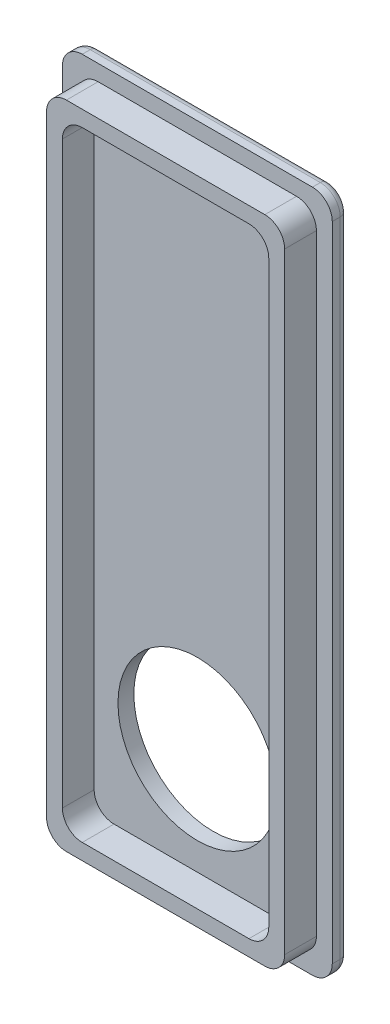
from build123d import *

# Parameters (mm, degrees)
ESQUISSE1_W             = 34
ESQUISSE1_H             = 86
BOSS_EXTRU_1_DEPTH      = 2
ESQUISSE2_W             = 30
ESQUISSE2_H             = 82
ESQUISSE2_W_2           = 26
ESQUISSE2_H_2           = 78
BOSS_EXTRU_2_DEPTH      = 4
CONG_3_R                = 1
CONG_2_R                = 2.5
ESQUISSE3_R             = 10
ENL_V_MAT_EXTRU_1_DEPTH = 4


with BuildPart() as part:
    # Esquisse1 → Boss.-Extru.1 (new body)
    with BuildSketch(Plane.XY):
        Rectangle(ESQUISSE1_W, ESQUISSE1_H)
    extrude(amount=BOSS_EXTRU_1_DEPTH)

    # Esquisse2 → Boss.-Extru.2 (add)
    with BuildSketch(Plane.XY.offset(2)):
        Rectangle(ESQUISSE2_W, ESQUISSE2_H)
        Rectangle(ESQUISSE2_W_2, ESQUISSE2_H_2, mode=Mode.SUBTRACT)
    extrude(amount=BOSS_EXTRU_2_DEPTH)

    # Congé3
    cong_3_edges = [part.edges().sort_by_distance(p)[0] for p in [
        (0, 43, 0),
        (17, 0, 0),
        (0, -43, 0),
        (-17, 0, 0),
    ]]
    fillet(cong_3_edges, radius=CONG_3_R)

    # Congé2
    # the kernel refuses this fillet: 2.5 mm, written as the material it adds along each edge
    with BuildSketch(Plane(origin=(-13, -39, 2), x_dir=(0, 1, 0), z_dir=(0, 0, 1)), Plane(origin=(13, 39, 2), x_dir=(0, -1, 0), z_dir=(0, 0, 1)), Plane(origin=(-13, 39, 2), x_dir=(1, 0, 0), z_dir=(0, 0, 1))) as cong_2_piece_1:
        with BuildLine():
            CenterArc((CONG_2_R, -CONG_2_R), CONG_2_R, 90, 90)
            Line((0, -CONG_2_R), (-CONG_2_R * 0.02, -CONG_2_R))
            Line((-CONG_2_R * 0.02, -CONG_2_R), (-CONG_2_R * 0.02, CONG_2_R * 0.02))
            Line((-CONG_2_R * 0.02, CONG_2_R * 0.02), (CONG_2_R, CONG_2_R * 0.02))
            Line((CONG_2_R, CONG_2_R * 0.02), (CONG_2_R, 0))
        make_face()
    extrude(amount=4)
    with BuildSketch(Plane(origin=(13, -39, 2), x_dir=(0, 1, 0), z_dir=(0, 0, 1))) as cong_2_piece_2:
        with BuildLine():
            CenterArc((CONG_2_R, CONG_2_R), CONG_2_R, 180, 90)
            Line((0, CONG_2_R), (-CONG_2_R * 0.02, CONG_2_R))
            Line((-CONG_2_R * 0.02, CONG_2_R), (-CONG_2_R * 0.02, -CONG_2_R * 0.02))
            Line((-CONG_2_R * 0.02, -CONG_2_R * 0.02), (CONG_2_R, -CONG_2_R * 0.02))
            Line((CONG_2_R, -CONG_2_R * 0.02), (CONG_2_R, 0))
        make_face()
    extrude(amount=4)
    # the kernel refuses this fillet: 2.5 mm, written as the material it takes off along each edge
    with BuildSketch(Plane(origin=(14.5, 40.5, 0), x_dir=(0, 1, 0), z_dir=(-1, 0, 0))) as cong_2_2_piece_1:
        with BuildLine():
            CenterArc((1.5, -1), 1, 0, 90)
            Line((2.5, -1), (2.5, 0))
            Line((2.5, 0), (1.5, 0))
        make_face()
    revolve(axis=Axis((14.5, 40.5, 0), (0, 0, -1)), revolution_arc=90, mode=Mode.SUBTRACT)
    with BuildSketch(Plane(origin=(14.5, -40.5, 0), x_dir=(1, 0, 0), z_dir=(0, 1, 0))) as cong_2_2_piece_2:
        with BuildLine():
            CenterArc((1.5, -1), 1, 0, 90)
            Line((2.5, -1), (2.5, 0))
            Line((2.5, 0), (1.5, 0))
        make_face()
    revolve(axis=Axis((14.5, -40.5, 0), (0, 0, -1)), revolution_arc=90, mode=Mode.SUBTRACT)
    with BuildSketch(Plane(origin=(-14.5, 40.5, 0), x_dir=(-1, 0, 0), z_dir=(0, -1, 0))) as cong_2_2_piece_3:
        with BuildLine():
            CenterArc((1.5, -1), 1, 0, 90)
            Line((2.5, -1), (2.5, 0))
            Line((2.5, 0), (1.5, 0))
        make_face()
    revolve(axis=Axis((-14.5, 40.5, 0), (0, 0, -1)), revolution_arc=90, mode=Mode.SUBTRACT)
    with BuildSketch(Plane(origin=(-14.5, -40.5, 0), x_dir=(0, -1, 0), z_dir=(1, 0, 0))) as cong_2_2_piece_4:
        with BuildLine():
            CenterArc((1.5, -1), 1, 0, 90)
            Line((2.5, -1), (2.5, 0))
            Line((2.5, 0), (1.5, 0))
        make_face()
    revolve(axis=Axis((-14.5, -40.5, 0), (0, 0, -1)), revolution_arc=90, mode=Mode.SUBTRACT)
    with BuildSketch(Plane(origin=(-15, 41, 2), x_dir=(0, -1, 0), z_dir=(0, 0, 1)), Plane(origin=(-15, -41, 2), x_dir=(1, 0, 0), z_dir=(0, 0, 1)), Plane(origin=(15, 41, 2), x_dir=(-1, 0, 0), z_dir=(0, 0, 1))) as cong_2_2_piece_5:
        with BuildLine():
            CenterArc((CONG_2_R, CONG_2_R), CONG_2_R, 180, 90)
            Line((0, CONG_2_R), (-CONG_2_R * 0.02, CONG_2_R))
            Line((-CONG_2_R * 0.02, CONG_2_R), (-CONG_2_R * 0.02, -CONG_2_R * 0.02))
            Line((-CONG_2_R * 0.02, -CONG_2_R * 0.02), (CONG_2_R, -CONG_2_R * 0.02))
            Line((CONG_2_R, -CONG_2_R * 0.02), (CONG_2_R, 0))
        make_face()
    extrude(amount=4, mode=Mode.SUBTRACT)
    with BuildSketch(Plane(origin=(15, -41, 2), x_dir=(-1, 0, 0), z_dir=(0, 0, 1))) as cong_2_2_piece_6:
        with BuildLine():
            CenterArc((CONG_2_R, -CONG_2_R), CONG_2_R, 90, 90)
            Line((0, -CONG_2_R), (-CONG_2_R * 0.02, -CONG_2_R))
            Line((-CONG_2_R * 0.02, -CONG_2_R), (-CONG_2_R * 0.02, CONG_2_R * 0.02))
            Line((-CONG_2_R * 0.02, CONG_2_R * 0.02), (CONG_2_R, CONG_2_R * 0.02))
            Line((CONG_2_R, CONG_2_R * 0.02), (CONG_2_R, 0))
        make_face()
    extrude(amount=4, mode=Mode.SUBTRACT)
    with BuildSketch(Plane(origin=(-17, 43, 0), x_dir=(0, -1, 0), z_dir=(0, 0, 1)), Plane(origin=(-17, -43, 0), x_dir=(1, 0, 0), z_dir=(0, 0, 1))) as cong_2_2_piece_7:
        with BuildLine():
            CenterArc((CONG_2_R, CONG_2_R), CONG_2_R, 180, 90)
            Line((0, CONG_2_R), (-CONG_2_R * 0.02, CONG_2_R))
            Line((-CONG_2_R * 0.02, CONG_2_R), (-CONG_2_R * 0.02, -CONG_2_R * 0.02))
            Line((-CONG_2_R * 0.02, -CONG_2_R * 0.02), (CONG_2_R, -CONG_2_R * 0.02))
            Line((CONG_2_R, -CONG_2_R * 0.02), (CONG_2_R, 0))
        make_face()
    extrude(amount=2, mode=Mode.SUBTRACT)
    with BuildSketch(Plane(origin=(17, 43, 0), x_dir=(0, -1, 0), z_dir=(0, 0, 1)), Plane(origin=(17, -43, 0), x_dir=(-1, 0, 0), z_dir=(0, 0, 1))) as cong_2_2_piece_8:
        with BuildLine():
            CenterArc((CONG_2_R, -CONG_2_R), CONG_2_R, 90, 90)
            Line((0, -CONG_2_R), (-CONG_2_R * 0.02, -CONG_2_R))
            Line((-CONG_2_R * 0.02, -CONG_2_R), (-CONG_2_R * 0.02, CONG_2_R * 0.02))
            Line((-CONG_2_R * 0.02, CONG_2_R * 0.02), (CONG_2_R, CONG_2_R * 0.02))
            Line((CONG_2_R, CONG_2_R * 0.02), (CONG_2_R, 0))
        make_face()
    extrude(amount=2, mode=Mode.SUBTRACT)

    # Esquisse3 → Enlèv. mat.-Extru.1 (cut)
    with BuildSketch(Plane(origin=(0, 0, 0), x_dir=(-1, 0, 0), z_dir=(0, 0, -1))):
        with Locations((0, -25.553422343)):
            Circle(ESQUISSE3_R)
    extrude(amount=-ENL_V_MAT_EXTRU_1_DEPTH, mode=Mode.SUBTRACT)


solid = part.part
